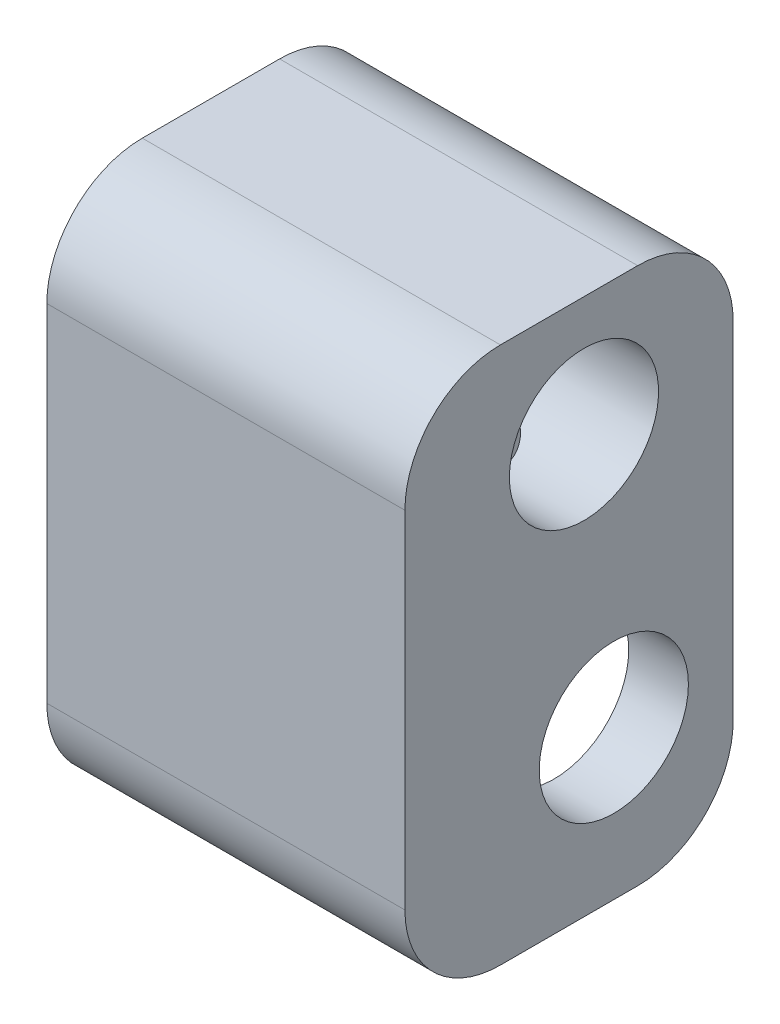
from build123d import *

# Parameters (mm, degrees)
SKETCH1_W           = 5.5
SKETCH1_H           = 9
SKETCH1_R           = 1.25
BOSS_EXTRUDE1_DEPTH = 6
CUT_EXTRUDE3_DEPTH  = 4.5
CUT_EXTRUDE4_REACH  = 14.135
SKETCH5_R           = 1.25
FILLET1_R           = 1.6


with BuildPart() as part:
    # Sketch1 → Boss-Extrude1 (new body)
    with BuildSketch(Plane(origin=(0, 0, 0), x_dir=(0, 0, -1), z_dir=(1, 0, 0))):
        with Locations((2.75, 4.5)):
            Rectangle(SKETCH1_W, SKETCH1_H)
        with Locations((3.5, 2.5)):
            Circle(SKETCH1_R, mode=Mode.SUBTRACT)
    extrude(amount=BOSS_EXTRUDE1_DEPTH)

    # Sketch4 → Cut-Extrude3 (cut)
    with BuildSketch(Plane(origin=(0, 0, -5.5), x_dir=(-1, 0, 0), z_dir=(0, 0, -1))):
        with BuildLine():
            Line((-5, 0), (-5, 4.8))
            ThreePointArc((-5, 4.8), (-3.75, 6.05), (-2.5, 4.8))
            Line((-2.5, 4.8), (-2.5, 0))
            ThreePointArc((-2.5, 0), (-3.75, -1.25), (-5, 0))
        make_face()
    extrude(amount=-CUT_EXTRUDE3_DEPTH, mode=Mode.SUBTRACT)

    # Sketch5 → Cut-Extrude4 (cut, up to next)
    with BuildSketch(Plane.ZY, mode=Mode.PRIVATE) as cut_extrude4_sk1:
        with Locations((-3, 7)):
            Circle(SKETCH5_R)
    cut_extrude4_tool1 = extrude(cut_extrude4_sk1.sketch, amount=-CUT_EXTRUDE4_REACH, mode=Mode.PRIVATE) & part.part
    add(cut_extrude4_tool1.solids().sort_by_distance((0, 7, -3))[0], mode=Mode.SUBTRACT)

    # Fillet1
    # the kernel refuses this fillet: 1.6 mm, written as the material it takes off along each edge
    with BuildSketch(Plane(origin=(-4, 0, 0), x_dir=(0, 0, -1), z_dir=(1, 0, 0)), Plane(origin=(-4, 9, 0), x_dir=(0, -1, 0), z_dir=(1, 0, 0))) as fillet1_piece_1:
        with BuildLine():
            CenterArc((FILLET1_R, FILLET1_R), FILLET1_R, 180, 90)
            Line((0, FILLET1_R), (0, 0))
            Line((0, 0), (FILLET1_R, 0))
        make_face()
    extrude(amount=14, mode=Mode.SUBTRACT)
    with BuildSketch(Plane(origin=(1, 0, -5.5), x_dir=(0, 0, 1), z_dir=(1, 0, 0))) as fillet1_piece_2:
        with BuildLine():
            CenterArc((FILLET1_R, -FILLET1_R), FILLET1_R, 90, 90)
            Line((0, -FILLET1_R), (0, 0))
            Line((0, 0), (FILLET1_R, 0))
        make_face()
    extrude(amount=9, mode=Mode.SUBTRACT)
    with BuildSketch(Plane(origin=(-4, 0, -5.5), x_dir=(0, 0, 1), z_dir=(1, 0, 0))) as fillet1_piece_3:
        with BuildLine():
            CenterArc((FILLET1_R, -FILLET1_R), FILLET1_R, 90, 90)
            Line((0, -FILLET1_R), (0, 0))
            Line((0, 0), (FILLET1_R, 0))
        make_face()
    extrude(amount=10.5, mode=Mode.SUBTRACT)
    with BuildSketch(Plane(origin=(-4, 9, -5.5), x_dir=(0, -1, 0), z_dir=(1, 0, 0))) as fillet1_piece_4:
        with BuildLine():
            CenterArc((FILLET1_R, -FILLET1_R), FILLET1_R, 90, 90)
            Line((0, -FILLET1_R), (0, 0))
            Line((0, 0), (FILLET1_R, 0))
        make_face()
    extrude(amount=14, mode=Mode.SUBTRACT)


solid = part.part
